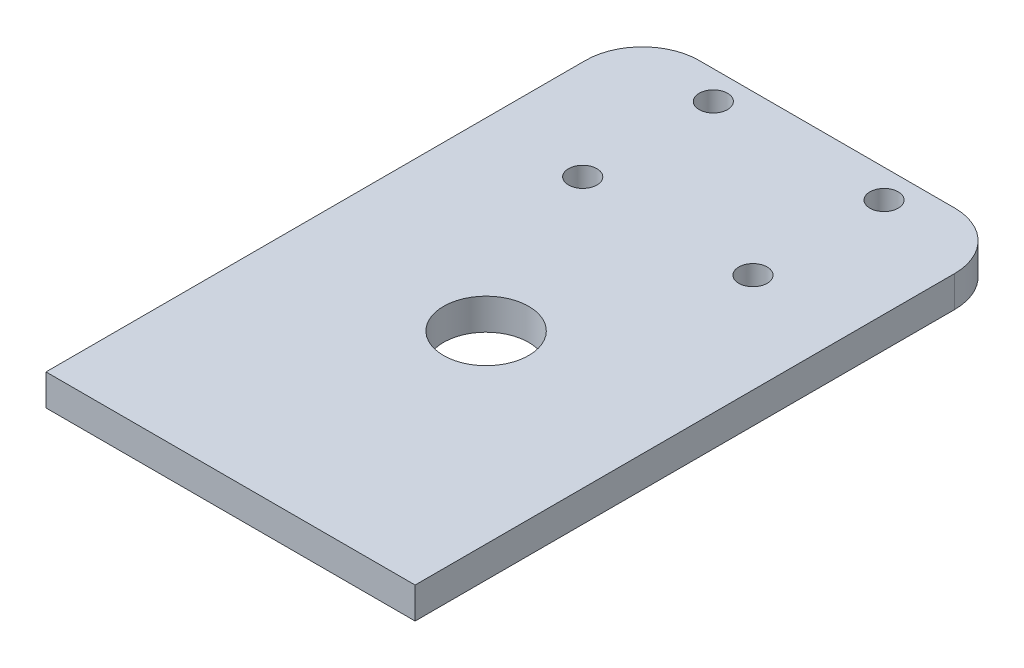
from build123d import *

# Parameters (mm, degrees)
CROQUIS1_W              = 65
CROQUIS1_H              = 105
CROQUIS1_R              = 2.5
CROQUIS1_R_2            = 7.5
SALIENTE_EXTRUIR1_DEPTH = 5.5
REDONDEO1_R             = 10
REDONDEO2_R             = 10


with BuildPart() as part:
    # Croquis1 → Saliente-Extruir1 (new body)
    with BuildSketch(Plane(origin=(0, 0, 0), x_dir=(1, 0, 0), z_dir=(0, 1, 0))):
        with Locations((-67.915753059, -46.422764228)):
            Rectangle(CROQUIS1_W, CROQUIS1_H)
        with Locations((-82.906504065, 1.077235772)):
            Circle(CROQUIS1_R, mode=Mode.SUBTRACT)
        with Locations((-52.839911308, 1.077235772)):
            Circle(CROQUIS1_R, mode=Mode.SUBTRACT)
        with Locations((-82.906504065, -21.922764228)):
            Circle(CROQUIS1_R, mode=Mode.SUBTRACT)
        with Locations((-52.925002053, -21.922764228)):
            Circle(CROQUIS1_R, mode=Mode.SUBTRACT)
        with Locations((-67.915753059, -53.922764228)):
            Circle(CROQUIS1_R_2, mode=Mode.SUBTRACT)
    extrude(amount=SALIENTE_EXTRUIR1_DEPTH)

    # Redondeo1
    redondeo1_edges = [part.edges().sort_by_distance(p)[0] for p in [
        (-35.415753059, 2.75, -6.077235772),
    ]]
    fillet(redondeo1_edges, radius=REDONDEO1_R)

    # Redondeo2
    redondeo2_edges = [part.edges().sort_by_distance(p)[0] for p in [
        (-100.415753059, 2.75, -6.077235772),
    ]]
    fillet(redondeo2_edges, radius=REDONDEO2_R)


solid = part.part
